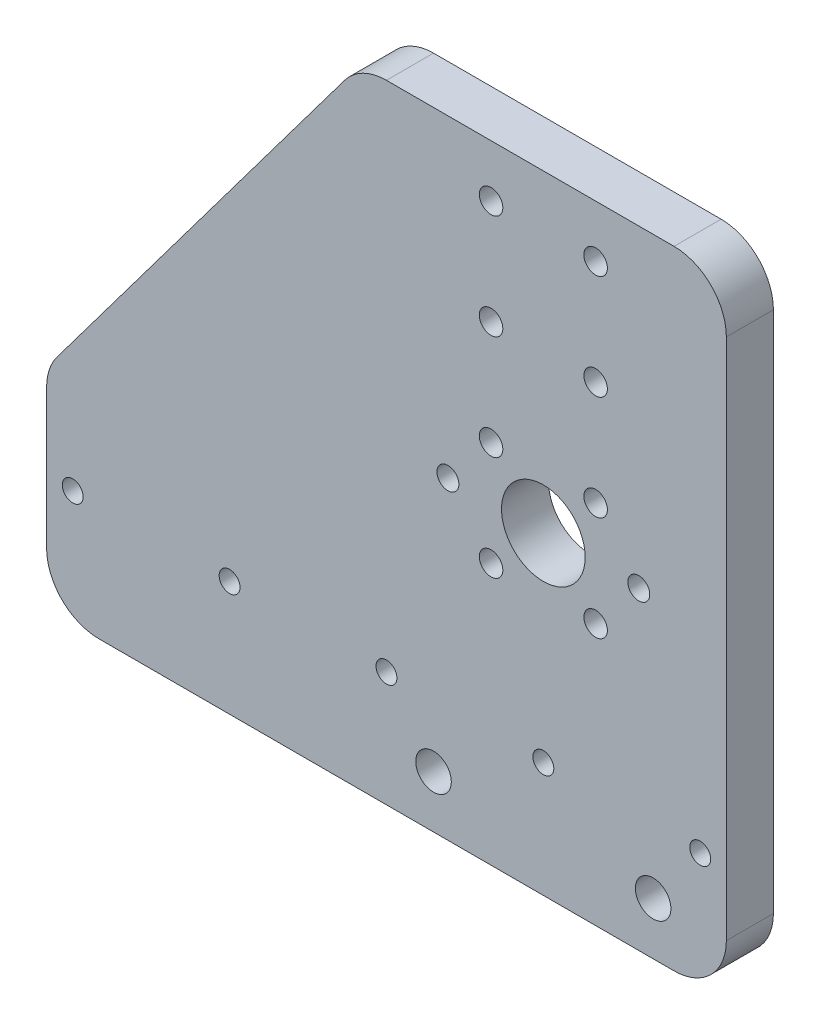
from build123d import *

# Parameters (mm, degrees)
BOSS_EXTRU_1_DEPTH      = 9
ESQUISSE2_R             = 2
ESQUISSE2_R_2           = 2.25
ENL_V_MAT_EXTRU_1_DEPTH = 178.146831753
ESQUISSE3_R             = 8
ESQUISSE3_R_2           = 3.4
ENL_V_MAT_EXTRU_2_DEPTH = 178.146831753
CONG_1_R                = 10
ESQUISSE6_R             = 2.1
ENL_V_MAT_EXTRU_4_DEPTH = 178.146831753


with BuildPart() as part:
    # Esquisse1 → Boss.-Extru.1 (new body)
    with BuildSketch(Plane.XY):
        Polygon((0, 0), (130, 0), (130, 120), (60, 120), (0, 40), align=None)
    extrude(amount=BOSS_EXTRU_1_DEPTH)

    # Esquisse2 → Enlèv. mat.-Extru.1 (cut, through all)
    with BuildSketch(Plane.XY.offset(9)):
        with Locations((65, 22)):
            Circle(ESQUISSE2_R)
        with Locations((35, 22)):
            Circle(ESQUISSE2_R)
        with Locations((5, 22)):
            Circle(ESQUISSE2_R)
        with Locations((125, 22)):
            Circle(ESQUISSE2_R)
        with Locations((95, 22)):
            Circle(ESQUISSE2_R)
        with Locations((85, 110)):
            Circle(ESQUISSE2_R_2)
        with Locations((85, 90)):
            Circle(ESQUISSE2_R_2)
        with Locations((105, 90)):
            Circle(ESQUISSE2_R_2)
        with Locations((105, 110)):
            Circle(ESQUISSE2_R_2)
        with Locations((105, 50)):
            Circle(ESQUISSE2_R_2)
        with Locations((105, 70)):
            Circle(ESQUISSE2_R_2)
        with Locations((85, 70)):
            Circle(ESQUISSE2_R_2)
        with Locations((85, 50)):
            Circle(ESQUISSE2_R_2)
    extrude(amount=-ENL_V_MAT_EXTRU_1_DEPTH, mode=Mode.SUBTRACT)

    # Esquisse3 → Enlèv. mat.-Extru.2 (cut, through all)
    with BuildSketch(Plane.XY.offset(9)):
        with Locations((95, 60)):
            Circle(ESQUISSE3_R)
        with Locations((74, 10)):
            Circle(ESQUISSE3_R_2)
        with Locations((116, 10)):
            Circle(ESQUISSE3_R_2)
    extrude(amount=-ENL_V_MAT_EXTRU_2_DEPTH, mode=Mode.SUBTRACT)

    # Congé1
    cong_1_edges = [part.edges().sort_by_distance(p)[0] for p in [
        (0, 40, 4.5),
        (60, 120, 4.5),
        (130, 120, 4.5),
        (130, 0, 4.5),
        (0, 0, 4.5),
    ]]
    fillet(cong_1_edges, radius=CONG_1_R)

    # Esquisse6 → Enlèv. mat.-Extru.4 (cut, through all)
    with BuildSketch(Plane(origin=(0, 0, 0), x_dir=(-1, 0, 0), z_dir=(0, 0, -1))):
        with Locations((-113.25, 60)):
            Circle(ESQUISSE6_R)
        with Locations((-76.75, 60)):
            Circle(ESQUISSE6_R)
    extrude(amount=-ENL_V_MAT_EXTRU_4_DEPTH, mode=Mode.SUBTRACT)


solid = part.part
